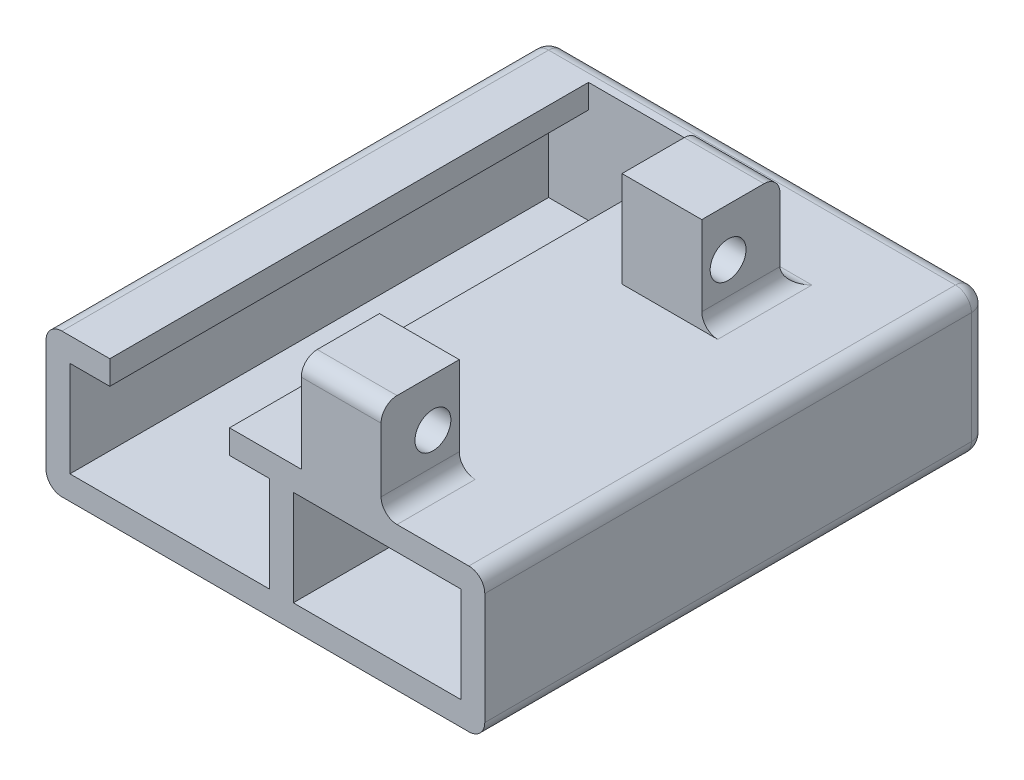
from build123d import *

# Parameters (mm, degrees)
SKETCH1_W           = 21
SKETCH1_H           = 12
BOSS_EXTRUDE1_DEPTH = 60
SKETCH2_R           = 2.25
BOSS_EXTRUDE2_DEPTH = 10
SKETCH3_W           = 55
SKETCH3_H           = 18
BOSS_EXTRUDE3_DEPTH = 3
FILLET1_R           = 2


with BuildPart() as part:
    # Sketch1 → Boss-Extrude1 (new body)
    with BuildSketch(Plane.XY):
        Polygon((17.509291985, 21.588576814), (-9.490708015, 21.588576814), (-14.490708015, 21.588576814), (-14.490708015, 18.588576814), (-9.490708015, 18.588576814), (-9.490708015, 6.588576814), (-34.490708015, 6.588576814), (-34.490708015, 18.588576814), (-29.490708015, 18.588576814), (-29.490708015, 21.588576814), (-34.490708015, 21.588576814), (-37.490708015, 21.588576814), (-37.490708015, 3.588576814), (17.509291985, 3.588576814), align=None)
        with Locations((4.009291985, 12.588576814)):
            Rectangle(SKETCH1_W, SKETCH1_H, mode=Mode.SUBTRACT)
    extrude(amount=-BOSS_EXTRUDE1_DEPTH)

    # Sketch2 → Boss-Extrude2 (add)
    # profile 1 of 2: a face of its own
    with BuildSketch(Plane(origin=(-5.490708015, 0, 0), x_dir=(0, 0, -1), z_dir=(1, 0, 0))):
        with BuildLine():
            Line((50, 21.588576814), (40.2, 21.588576814))
            Line((40.2, 21.588576814), (40.2, 33.588576814))
            Line((40.2, 33.588576814), (48, 33.588576814))
            ThreePointArc((48, 33.588576814), (49.414213562, 33.002790376), (50, 31.588576814))
            Line((50, 31.588576814), (50, 21.588576814))
        make_face()
        with Locations((43.5, 27.588576814)):
            Circle(SKETCH2_R, mode=Mode.SUBTRACT)
    # profile 2 of 2: a face of its own
    with BuildSketch(Plane(origin=(-5.490708015, 0, 0), x_dir=(0, 0, -1), z_dir=(1, 0, 0))):
        with BuildLine():
            Line((9.8, 21.588576814), (0, 21.588576814))
            Line((0, 21.588576814), (0, 31.588576814))
            ThreePointArc((0, 31.588576814), (0.585786438, 33.002790376), (2, 33.588576814))
            Line((2, 33.588576814), (9.8, 33.588576814))
            Line((9.8, 33.588576814), (9.8, 21.588576814))
        make_face()
        with Locations((6.5, 27.588576814)):
            Circle(SKETCH2_R, mode=Mode.SUBTRACT)
    extrude(amount=BOSS_EXTRUDE2_DEPTH)

    # Sketch3 → Boss-Extrude3 (add)
    with BuildSketch(Plane(origin=(0, 0, -60), x_dir=(-1, 0, 0), z_dir=(0, 0, -1))):
        with Locations((9.990708015, 12.588576814)):
            Rectangle(SKETCH3_W, SKETCH3_H)
    extrude(amount=BOSS_EXTRUDE3_DEPTH)

    # Fillet1
    fillet1_edges = [part.edges().sort_by_distance(p)[0] for p in [
        (17.509291985, 21.588576814, -31.5),
        (17.509291985, 3.588576814, -31.5),
        (-37.490708015, 3.588576814, -31.5),
        (-37.490708015, 21.588576814, -31.5),
        (-9.990708015, 21.588576814, -63),
        (-37.490708015, 12.588576814, -63),
        (-9.990708015, 3.588576814, -63),
        (17.509291985, 12.588576814, -63),
        (4.509291985, 21.588576814, -4.9),
        (-0.490708015, 21.588576814, -50),
        (4.509291985, 21.588576814, -45.1),
    ]]
    fillet(fillet1_edges, radius=FILLET1_R)


solid = part.part
